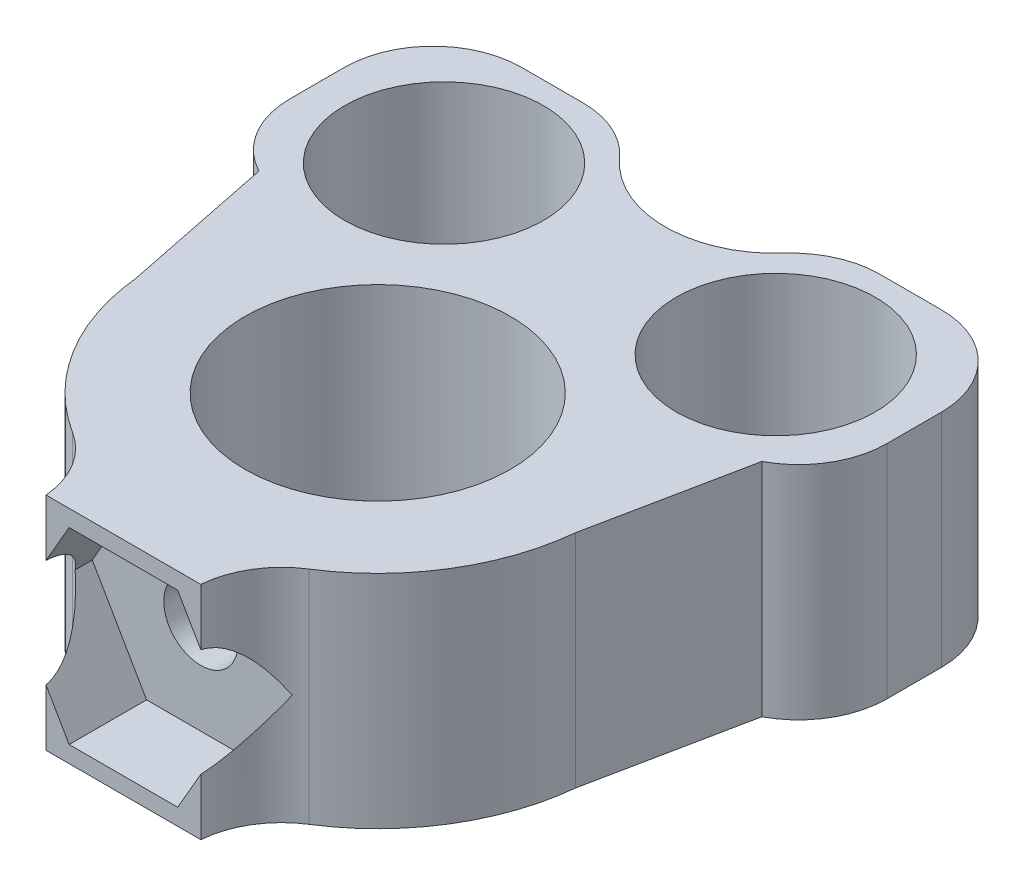
from build123d import *

# Parameters (mm, degrees)
CROQUIS1_R              = 10
CROQUIS1_R_2            = 6
SALIENTE_EXTRUIR1_DEPTH = 10
CROQUIS2_R              = 4.5
CORTAR_EXTRUIR1_DEPTH   = 10
CHAFL_N1_DEPTH          = 10
CROQUIS3_W              = 7
CROQUIS3_H              = 3
SALIENTE_EXTRUIR2_DEPTH = 10
CROQUIS4_R              = 1.675
CORTAR_EXTRUIR2_DEPTH   = 10
REDONDEO2_R             = 4
CORTAR_EXTRUIR3_DEPTH   = 3.5


with BuildPart() as part:
    # Croquis1 → Saliente-Extruir1 (new body)
    # profile 1 of 2: a face of its own
    with BuildSketch(Plane(origin=(0, 0, 0), x_dir=(1, 0, 0), z_dir=(0, 1, 0))):
        Circle(CROQUIS1_R)
        with Locations(Location((0, 0, 0), (0, 0, 270))):
            Circle(CROQUIS1_R_2, mode=Mode.SUBTRACT)
    # profile 2 of 2: a face of its own
    with BuildSketch(Plane(origin=(0, 0, 0), x_dir=(1, 0, 0), z_dir=(0, 1, 0))):
        with BuildLine():
            Line((-13.5, 16), (-4.582575695, 16))
            ThreePointArc((-4.582575695, 16), (0, 13), (4.582575695, 16))
            Line((4.582575695, 16), (13.5, 16))
            Line((13.5, 16), (13.5, 6))
            Line((13.5, 6), (-13.5, 6))
            Line((-13.5, 6), (-13.5, 16))
        make_face()
    extrude(amount=SALIENTE_EXTRUIR1_DEPTH)

    # Croquis2 → Cortar-Extruir1 (cut)
    with BuildSketch(Plane(origin=(0, 10, 0), x_dir=(1, 0, 0), z_dir=(0, 1, 0))):
        with Locations(Location((-7.5, 10.5, 0), (0, 0, 270))):
            Circle(CROQUIS2_R)
        with Locations(Location((7.5, 10.5, 0), (0, 0, 270))):
            Circle(CROQUIS2_R)
    extrude(amount=-CORTAR_EXTRUIR1_DEPTH, mode=Mode.SUBTRACT)

    # Chaflán1: read off the stored shape, not the designer's step
    # Chaflán1 outline → Chaflán1 (add)
    with BuildSketch(Plane(origin=(0, 0, 0), x_dir=(1, 0, 0), z_dir=(0, 1, 0))):
        with BuildLine():
            ThreePointArc((8, 6), (9.633249581, 2.68337521), (9.949874371, -1))
            Line((9.949874371, -1), (11.371284996, 6))
            Line((11.371284996, 6), (8, 6))
        make_face()
        with BuildLine():
            Line((-11.371284996, 6), (-9.949874371, -1))
            ThreePointArc((-9.949874371, -1), (-9.633249581, 2.68337521), (-8, 6))
            Line((-8, 6), (-11.371284996, 6))
        make_face()
    extrude(amount=CHAFL_N1_DEPTH)

    # Croquis3 → Saliente-Extruir2 (add)
    with BuildSketch(Plane(origin=(0, 0, 0), x_dir=(1, 0, 0), z_dir=(0, 1, 0))):
        with Locations((0, -10)):
            Rectangle(CROQUIS3_W, CROQUIS3_H)
    extrude(amount=SALIENTE_EXTRUIR2_DEPTH)

    # Croquis4 → Cortar-Extruir2 (cut)
    with BuildSketch(Plane.XY.offset(11.5)):
        with Locations((0, 5)):
            Circle(CROQUIS4_R)
    extrude(amount=-CORTAR_EXTRUIR2_DEPTH, mode=Mode.SUBTRACT)

    # Redondeo2
    # the kernel refuses this fillet: 4 mm, written as the material it adds along each edge
    with BuildSketch(Plane(origin=(-3.5, 10, 9.367496998), x_dir=(-0.8956592986601979, 0, -0.4447408467001005), z_dir=(0, -1, 0))) as redondeo2_piece_1:
        with BuildLine():
            CenterArc((2.475122402, -3.978671502), REDONDEO2_R, 95.919444292, 52.938021971)
            Line((-0.948411191, -1.909996144), (-1.016881863, -1.868622636))
            ThreePointArc((-1.016881863, -1.868622636), (-0.545858339, -0.919418804), (-0.071652744, 0.035579268))
            Line((-0.071652744, 0.035579268), (0.008250408, 0.07957343))
            ThreePointArc((0.008250408, 0.07957343), (1.031301001, 0.026678755), (2.054351594, 0.07957343))
            Line((2.054351594, 0.07957343), (2.062602002, 0))
        make_face()
    extrude(amount=10)
    with BuildSketch(Plane(origin=(3.5, 10, 9.367496998), x_dir=(0, 0, 1), z_dir=(0, -1, 0))) as redondeo2_piece_2:
        with BuildLine():
            CenterArc((2.462746094, -3.986344127), REDONDEO2_R, 94.735774331, 52.938021971)
            Line((-0.917323361, -1.847388662), (-0.98492475, -1.804609553))
            ThreePointArc((-0.98492475, -1.804609553), (-0.482556755, -0.911829199), (-0.074939976, 0.028))
            Line((-0.074939976, 0.028), (0, 0.08))
            ThreePointArc((0, 0.08), (1.066251501, 0.08), (2.125898141, 0.079726883))
            Line((2.125898141, 0.079726883), (2.132503002, 0))
        make_face()
    extrude(amount=10)
    # the kernel refuses this fillet: 4 mm, written as the material it takes off along each edge
    with BuildSketch(Plane(origin=(13.5, -10, -16), x_dir=(-1, 0, 0), z_dir=(0, 1, 0)), Plane(origin=(-13.5, -10, -16), x_dir=(0, 0, 1), z_dir=(0, 1, 0))) as redondeo2_2_piece_1:
        with BuildLine():
            CenterArc((REDONDEO2_R, REDONDEO2_R), REDONDEO2_R, 180, 90)
            Line((0, REDONDEO2_R), (-REDONDEO2_R * 0.02, REDONDEO2_R))
            Line((-REDONDEO2_R * 0.02, REDONDEO2_R), (-REDONDEO2_R * 0.02, -REDONDEO2_R * 0.02))
            Line((-REDONDEO2_R * 0.02, -REDONDEO2_R * 0.02), (REDONDEO2_R, -REDONDEO2_R * 0.02))
            Line((REDONDEO2_R, -REDONDEO2_R * 0.02), (REDONDEO2_R, 0))
        make_face()
    extrude(amount=30, mode=Mode.SUBTRACT)
    with BuildSketch(Plane(origin=(13.5, -8.838231039, -6), x_dir=(0, 0, -1), z_dir=(0, 1, 0))) as redondeo2_2_piece_2:
        with BuildLine():
            CenterArc((3.535292416, 4), REDONDEO2_R, 207.892961789, 62.107038211)
            Line((0, 2.128715004), (-0.070705848, 2.091289304))
            ThreePointArc((-0.070705848, 2.091289304), (-0.08, 1.064357502), (-0.08, 0))
            Line((-0.08, 0), (0, -0.08))
            Line((0, -0.08), (3.535292416, -0.08))
            Line((3.535292416, -0.08), (3.535292416, 0))
        make_face()
    extrude(amount=27.676462078, mode=Mode.SUBTRACT)
    with BuildSketch(Plane(origin=(-13.5, -8.838231039, -6), x_dir=(1, 0, 0), z_dir=(0, 1, 0))) as redondeo2_2_piece_3:
        with BuildLine():
            CenterArc((4, 3.535292416), REDONDEO2_R, 180, 62.107038211)
            Line((0, 3.535292416), (-0.08, 3.535292416))
            Line((-0.08, 3.535292416), (-0.08, 0))
            Line((-0.08, 0), (0, -0.08))
            ThreePointArc((0, -0.08), (1.064357502, -0.08), (2.091289304, -0.070705848))
            Line((2.091289304, -0.070705848), (2.128715004, 0))
        make_face()
    extrude(amount=27.676462078, mode=Mode.SUBTRACT)
    with BuildSketch(Plane(origin=(4.582575695, -5.314070594, -16), x_dir=(-0.5401558180759948, 0, 0.8415650255319863), z_dir=(0, 1, 0))) as redondeo2_2_piece_4:
        with BuildLine():
            CenterArc((2.218089643, 3.949477654), REDONDEO2_R, 212.694246687, 48.189685104)
            Line((-1.14817046, 1.788854382), (-1.215495662, 1.745641917))
            Line((-1.215495662, 1.745641917), (-0.067325202, -0.043212465))
            Line((-0.067325202, -0.043212465), (0.012674798, -0.078989553))
            ThreePointArc((0.012674798, -0.078989553), (0.792174872, -0.016847068), (1.571674947, -0.078989553))
            Line((1.571674947, -0.078989553), (1.584349745, 0))
        make_face()
    extrude(amount=20.628141188, mode=Mode.SUBTRACT)
    with BuildSketch(Plane(origin=(-4.582575695, -5.314070594, -16), x_dir=(-1, 0, 0), z_dir=(0, 1, 0))) as redondeo2_2_piece_5:
        with BuildLine():
            CenterArc((2.125628238, 4), REDONDEO2_R, 221.810314896, 48.189685104)
            Line((-0.855795732, 1.333333333), (-0.915424212, 1.28))
            ThreePointArc((-0.915424212, 1.28), (-0.442075769, 0.657566625), (-0.073321211, -0.032))
            Line((-0.073321211, -0.032), (0, -0.08))
            Line((0, -0.08), (2.125628238, -0.08))
            Line((2.125628238, -0.08), (2.125628238, 0))
        make_face()
    extrude(amount=20.628141188, mode=Mode.SUBTRACT)

    # Croquis5 → Cortar-Extruir3 (cut)
    with BuildSketch(Plane.XY.offset(11.5)):
        Polygon((4.907477288, 5), (2.453738644, 9.25), (-2.453738644, 9.25), (-4.907477288, 5), (-2.453738644, 0.75), (2.453738644, 0.75), align=None)
    extrude(amount=-CORTAR_EXTRUIR3_DEPTH, mode=Mode.SUBTRACT)


solid = part.part
